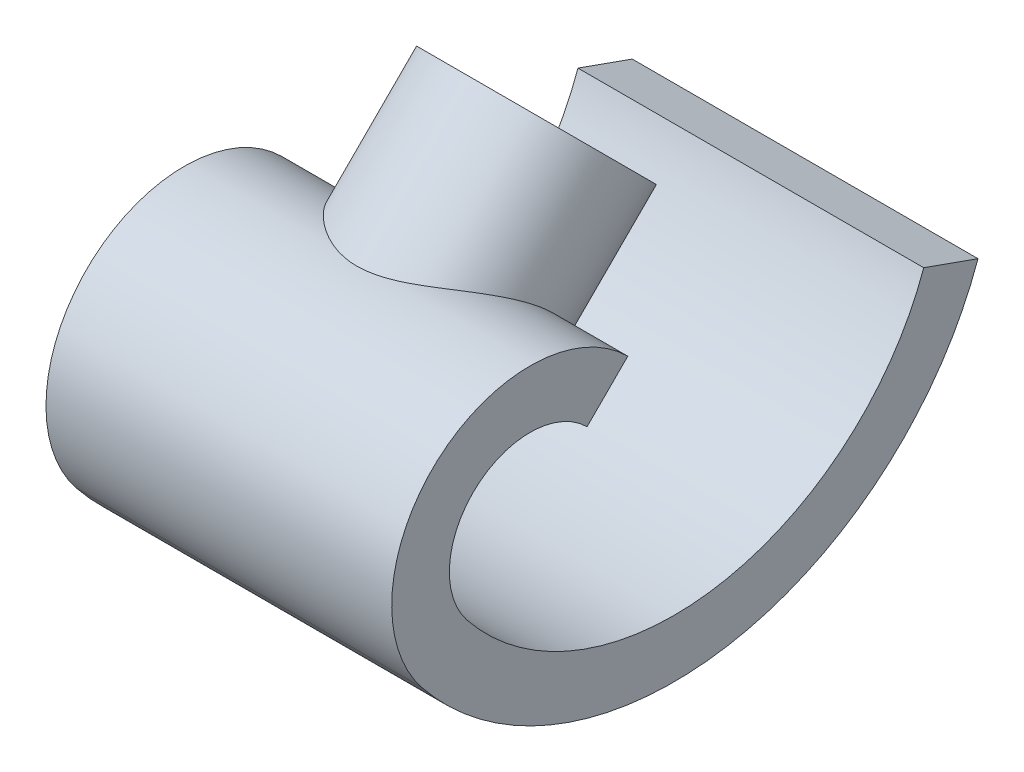
from build123d import *

# Parameters (mm, degrees)
EXTRUDE_THIN1_DEPTH      = 15
BOSS_EXTRUDE1_DEPTH      = 10
BOSS_EXTRUDE1_DEPTH_BACK = 4
SKETCH3_R                = 8.5
SKETCH3_R_2              = 4.5


with BuildPart() as part:
    # Sketch1 → Extrude-Thin1 (new, symmetric)
    with BuildSketch(Plane(origin=(0, 0, 0), x_dir=(0, 0, -1), z_dir=(1, 0, 0))):
        with BuildLine():
            ThreePointArc((-4.004714623, 8.485281374), (-20.494799633, 8.939973084), (-21.857492994, -7.5))
            ThreePointArc((-21.857492994, -7.5), (4.648037658, -17.611514734), (26.382299048, 0.620538558))
            Line((26.382299048, 0.620538558), (21.671174218, 2.295442387))
            ThreePointArc((21.671174218, 2.295442387), (3.818030934, -12.680887103), (-17.954369245, -4.375))
            ThreePointArc((-17.954369245, -4.375), (-17.159464785, 5.214984299), (-7.540248528, 4.949747468))
            Line((-7.540248528, 4.949747468), (-4.004714623, 8.485281374))
        make_face()
    extrude(amount=EXTRUDE_THIN1_DEPTH, both=True)

    # Sketch3 → Boss-Extrude1 (add, two sides: drawn at the far end of the back side and taken through both)
    with BuildSketch(Plane(origin=(0, 2.240283376, -2.240283376), x_dir=(1, 0, 0), z_dir=(0, 0.7071067811865508, -0.7071067811865444)).offset(-BOSS_EXTRUDE1_DEPTH_BACK)):
        with Locations((0, -8.831760866)):
            Circle(SKETCH3_R)
        with Locations((0, -8.831760866)):
            Circle(SKETCH3_R_2, mode=Mode.SUBTRACT)
    extrude(amount=BOSS_EXTRUDE1_DEPTH + BOSS_EXTRUDE1_DEPTH_BACK)


solid = part.part
